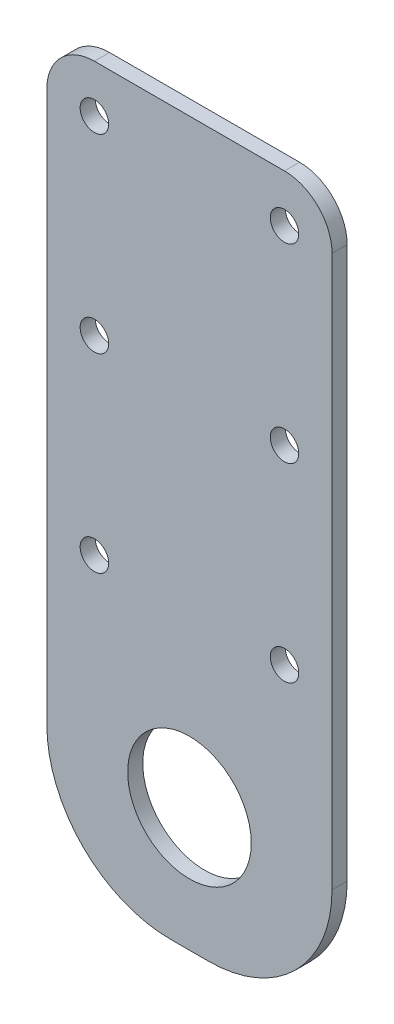
from build123d import *

# Parameters (mm, degrees)
SKETCH1_R           = 6.5
SKETCH1_R_2         = 1.5
BOSS_EXTRUDE1_DEPTH = 1.5875
FILLET1_R           = 5
FILLET2_R           = 13


with BuildPart() as part:
    # Sketch1 → Boss-Extrude1 (new body)
    with BuildSketch(Plane.XY):
        Polygon((0, 0), (0, 50), (30, 50), (30, 0), (30, -26), (0, -26), align=None)
        with Locations((15, -13)):
            Circle(SKETCH1_R, mode=Mode.SUBTRACT)
        with Locations((5, 45)):
            Circle(SKETCH1_R_2, mode=Mode.SUBTRACT)
        with Locations((5, 25)):
            Circle(SKETCH1_R_2, mode=Mode.SUBTRACT)
        with Locations((5, 5)):
            Circle(SKETCH1_R_2, mode=Mode.SUBTRACT)
        with Locations((25, 5)):
            Circle(SKETCH1_R_2, mode=Mode.SUBTRACT)
        with Locations((25, 25)):
            Circle(SKETCH1_R_2, mode=Mode.SUBTRACT)
        with Locations((25, 45)):
            Circle(SKETCH1_R_2, mode=Mode.SUBTRACT)
    extrude(amount=BOSS_EXTRUDE1_DEPTH)

    # Fillet1
    fillet1_edges = [part.edges().sort_by_distance(p)[0] for p in [
        (0, 50, 0.79375),
        (30, 50, 0.79375),
    ]]
    fillet(fillet1_edges, radius=FILLET1_R)

    # Fillet2
    fillet2_edges = [part.edges().sort_by_distance(p)[0] for p in [
        (30, -26, 0.79375),
        (0, -26, 0.79375),
    ]]
    fillet(fillet2_edges, radius=FILLET2_R)


solid = part.part
